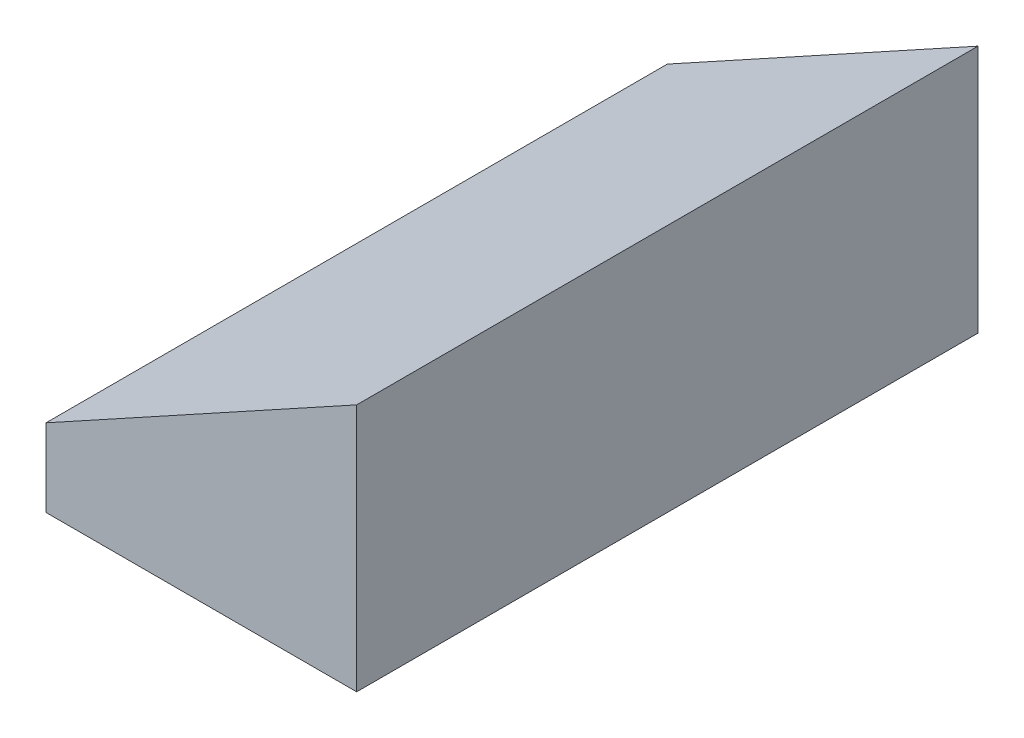
from build123d import *

# Parameters (mm, degrees)
BOSS_EXTRUDE1_DEPTH = 16
SKETCH4_W           = 4.8
SKETCH4_H           = 12.8
CUT_EXTRUDE2_DEPTH  = 1.8
SHELL1_START        = 1.6
SHELL1_DEPTH        = 12.8
SKETCH2_R           = 1.6
BOSS_EXTRUDE2_DEPTH = 3
SKETCH3_R           = 0.8
CUT_EXTRUDE1_DEPTH  = 3


# Read off the part's stored shape, not the designer's step: Shell1
with BuildPart() as part:
    # Sketch1 → Boss-Extrude1 (new body)
    with BuildSketch(Plane.XY):
        Polygon((0, 0), (0, 2), (8, 6.4), (8, 0), align=None)
    extrude(amount=BOSS_EXTRUDE1_DEPTH)

    # Sketch4 → Cut-Extrude2 (cut)
    with BuildSketch(Plane.XZ):
        with Locations((4, 8)):
            Rectangle(SKETCH4_W, SKETCH4_H)
    extrude(amount=-CUT_EXTRUDE2_DEPTH, mode=Mode.SUBTRACT)

    # Shell1 outline → Shell1 (cut)
    with BuildSketch(Plane.XY.offset(SHELL1_START)):
        Polygon((2.95642537, 1.8), (6.4, 1.8), (6.4, 3.693966046), align=None)
    extrude(amount=SHELL1_DEPTH, mode=Mode.SUBTRACT)

    # Sketch2 → Boss-Extrude2 (add)
    with BuildSketch(Plane.XZ):
        with Locations((4, 8)):
            Circle(SKETCH2_R)
    extrude(amount=-BOSS_EXTRUDE2_DEPTH)

    # Sketch3 → Cut-Extrude1 (cut)
    with BuildSketch(Plane.XZ):
        with Locations((4, 8)):
            Circle(SKETCH3_R)
    extrude(amount=-CUT_EXTRUDE1_DEPTH, mode=Mode.SUBTRACT)


solid = part.part
